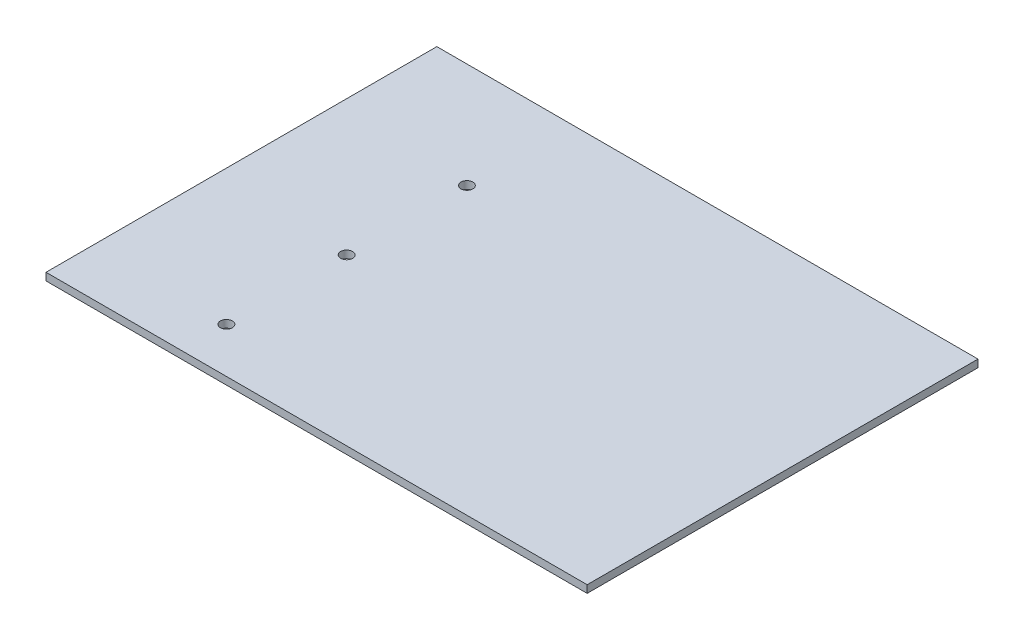
from build123d import *

# Parameters (mm, degrees)
SKETCH1_W               = 457.2
SKETCH1_H               = 330.2
BOSS_EXTRUDE1_DEPTH     = 6.35
SKETCH3_W               = 406.4
SKETCH3_H               = 6.35
SKETCH3_W_2             = 6.35
SKETCH3_H_2             = 304.8
BOSS_EXTRUDE2_DEPTH     = 25.4
F_3_8_CLEARANCE_HOLE1_D = 10.0838


with BuildPart() as part:
    # Sketch1 → Boss-Extrude1 (new body)
    with BuildSketch(Plane(origin=(0, 0, 0), x_dir=(1, 0, 0), z_dir=(0, 1, 0))):
        Rectangle(SKETCH1_W, SKETCH1_H)
    extrude(amount=BOSS_EXTRUDE1_DEPTH)

    # Sketch3 → Boss-Extrude2 (add)
    with BuildSketch(Plane.XZ):
        with Locations((0, -64.558333333)):
            Rectangle(SKETCH3_W, SKETCH3_H)
        with Locations((-147.410714286, -12.7)):
            Rectangle(SKETCH3_W_2, SKETCH3_H_2)
        with Locations((0, 39.158333333)):
            Rectangle(SKETCH3_W, SKETCH3_H)
        with Locations((-88.446428571, -12.7)):
            Rectangle(SKETCH3_W_2, SKETCH3_H_2)
        with Locations((-29.482142857, -12.7)):
            Rectangle(SKETCH3_W_2, SKETCH3_H_2)
        with Locations((29.482142857, -12.7)):
            Rectangle(SKETCH3_W_2, SKETCH3_H_2)
        with Locations((88.446428571, -12.7)):
            Rectangle(SKETCH3_W_2, SKETCH3_H_2)
        with Locations((147.410714286, -12.7)):
            Rectangle(SKETCH3_W_2, SKETCH3_H_2)
    extrude(amount=BOSS_EXTRUDE2_DEPTH)

    # 3/8 Clearance Hole1 (through all)
    with Locations(Plane(origin=(0, 6.35, -165.1), x_dir=(1, 0, 0), z_dir=(0, 1, 0))):
        with Locations((-114.300000003, -88.9), (-114.300000003, -190.5), (-114.300000003, -292.1)):
            Hole(F_3_8_CLEARANCE_HOLE1_D / 2)


solid = part.part
